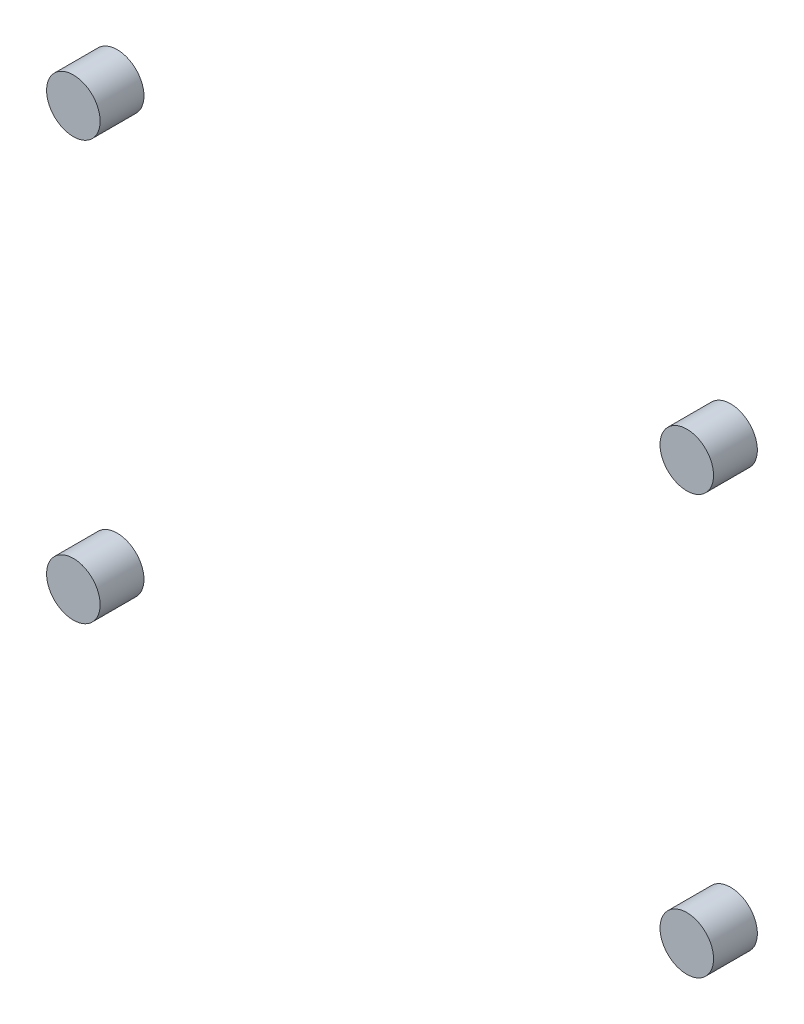
from build123d import *

# Parameters (mm, degrees)
SKETCH2_R             = 2.75
BOSS_EXTRUDE2_DEPTH   = 4.5
BOSS_EXTRUDE2_2_DEPTH = 4.5
BOSS_EXTRUDE2_3_DEPTH = 4.5
BOSS_EXTRUDE2_4_DEPTH = 4.5


with BuildPart() as part:
    # Sketch2 → Boss-Extrude2 (new body)
    with BuildSketch(Plane.XY):
        with Locations((-31.5, -21.5)):
            Circle(SKETCH2_R)
    extrude(amount=BOSS_EXTRUDE2_DEPTH)


with BuildPart() as body_2:
    # Sketch2 → Boss-Extrude2 2 (new body)
    with BuildSketch(Plane.XY):
        with Locations((31.5, -21.5)):
            Circle(SKETCH2_R)
    extrude(amount=BOSS_EXTRUDE2_2_DEPTH)


with BuildPart() as body_3:
    # Sketch2 → Boss-Extrude2 3 (new body)
    with BuildSketch(Plane.XY):
        with Locations((-31.5, 21.5)):
            Circle(SKETCH2_R)
    extrude(amount=BOSS_EXTRUDE2_3_DEPTH)


with BuildPart() as body_4:
    # Sketch2 → Boss-Extrude2 4 (new body)
    with BuildSketch(Plane.XY):
        with Locations((31.5, 21.5)):
            Circle(SKETCH2_R)
    extrude(amount=BOSS_EXTRUDE2_4_DEPTH)


solid = Compound([part.part, body_2.part, body_3.part, body_4.part])
